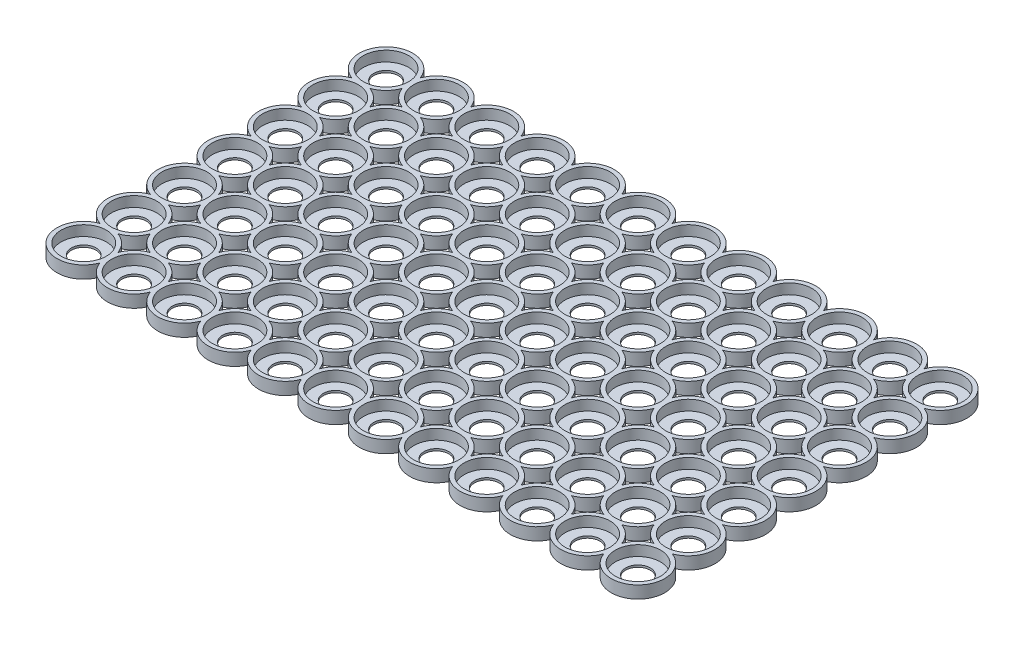
from build123d import *

# Parameters (mm, degrees)
LPATTERN1_COUNT = 7
LPATTERN1_PITCH = 24.5
LPATTERN2_COUNT = 12
LPATTERN2_PITCH = 24.5


with BuildPart() as part:
    # Sketch1 → Revolve1 (revolve)
    with BuildSketch(Plane(origin=(0, 0, 0), x_dir=(0, 0, -1), z_dir=(1, 0, 0))):
        Polygon((-13, 3), (-13, -3), (-6, -3), (-6, -2), (-11, -2), (-11, 3), align=None)
    revolve1 = revolve(axis=Axis((0, 27.077205882, 0), (0, -1, 0)))

    # LPattern1: Revolve1 ×7
    with Locations(*[(0, 0, -i * LPATTERN1_PITCH) for i in range(1, LPATTERN1_COUNT)]):
        add(revolve1)

    # LPattern2: Revolve1 ×12
    with Locations(*[(i * LPATTERN2_PITCH, 0, 0) for i in range(1, LPATTERN2_COUNT)]):
        add(revolve1)

    # LPattern2 copy 1 sketch → LPattern2 copy 1 (revolve)
    with BuildSketch(Plane(origin=(24.5, 0, -24.5), x_dir=(0, 0, -1), z_dir=(1, 0, 0))):
        Polygon((-13, 3), (-13, -3), (-6, -3), (-6, -2), (-11, -2), (-11, 3), align=None)
    revolve(axis=Axis((24.5, 27.077205882, -24.5), (0, -1, 0)))

    # LPattern2 copy 2 sketch → LPattern2 copy 2 (revolve)
    with BuildSketch(Plane(origin=(49, 0, -24.5), x_dir=(0, 0, -1), z_dir=(1, 0, 0))):
        Polygon((-13, 3), (-13, -3), (-6, -3), (-6, -2), (-11, -2), (-11, 3), align=None)
    revolve(axis=Axis((49, 27.077205882, -24.5), (0, -1, 0)))

    # LPattern2 copy 3 sketch → LPattern2 copy 3 (revolve)
    with BuildSketch(Plane(origin=(73.5, 0, -24.5), x_dir=(0, 0, -1), z_dir=(1, 0, 0))):
        Polygon((-13, 3), (-13, -3), (-6, -3), (-6, -2), (-11, -2), (-11, 3), align=None)
    revolve(axis=Axis((73.5, 27.077205882, -24.5), (0, -1, 0)))

    # LPattern2 copy 4 sketch → LPattern2 copy 4 (revolve)
    with BuildSketch(Plane(origin=(98, 0, -24.5), x_dir=(0, 0, -1), z_dir=(1, 0, 0))):
        Polygon((-13, 3), (-13, -3), (-6, -3), (-6, -2), (-11, -2), (-11, 3), align=None)
    revolve(axis=Axis((98, 27.077205882, -24.5), (0, -1, 0)))

    # LPattern2 copy 5 sketch → LPattern2 copy 5 (revolve)
    with BuildSketch(Plane(origin=(122.5, 0, -24.5), x_dir=(0, 0, -1), z_dir=(1, 0, 0))):
        Polygon((-13, 3), (-13, -3), (-6, -3), (-6, -2), (-11, -2), (-11, 3), align=None)
    revolve(axis=Axis((122.5, 27.077205882, -24.5), (0, -1, 0)))

    # LPattern2 copy 6 sketch → LPattern2 copy 6 (revolve)
    with BuildSketch(Plane(origin=(147, 0, -24.5), x_dir=(0, 0, -1), z_dir=(1, 0, 0))):
        Polygon((-13, 3), (-13, -3), (-6, -3), (-6, -2), (-11, -2), (-11, 3), align=None)
    revolve(axis=Axis((147, 27.077205882, -24.5), (0, -1, 0)))

    # LPattern2 copy 7 sketch → LPattern2 copy 7 (revolve)
    with BuildSketch(Plane(origin=(171.5, 0, -24.5), x_dir=(0, 0, -1), z_dir=(1, 0, 0))):
        Polygon((-13, 3), (-13, -3), (-6, -3), (-6, -2), (-11, -2), (-11, 3), align=None)
    revolve(axis=Axis((171.5, 27.077205882, -24.5), (0, -1, 0)))

    # LPattern2 copy 8 sketch → LPattern2 copy 8 (revolve)
    with BuildSketch(Plane(origin=(196, 0, -24.5), x_dir=(0, 0, -1), z_dir=(1, 0, 0))):
        Polygon((-13, 3), (-13, -3), (-6, -3), (-6, -2), (-11, -2), (-11, 3), align=None)
    revolve(axis=Axis((196, 27.077205882, -24.5), (0, -1, 0)))

    # LPattern2 copy 9 sketch → LPattern2 copy 9 (revolve)
    with BuildSketch(Plane(origin=(220.5, 0, -24.5), x_dir=(0, 0, -1), z_dir=(1, 0, 0))):
        Polygon((-13, 3), (-13, -3), (-6, -3), (-6, -2), (-11, -2), (-11, 3), align=None)
    revolve(axis=Axis((220.5, 27.077205882, -24.5), (0, -1, 0)))

    # LPattern2 copy 10 sketch → LPattern2 copy 10 (revolve)
    with BuildSketch(Plane(origin=(245, 0, -24.5), x_dir=(0, 0, -1), z_dir=(1, 0, 0))):
        Polygon((-13, 3), (-13, -3), (-6, -3), (-6, -2), (-11, -2), (-11, 3), align=None)
    revolve(axis=Axis((245, 27.077205882, -24.5), (0, -1, 0)))

    # LPattern2 copy 11 sketch → LPattern2 copy 11 (revolve)
    with BuildSketch(Plane(origin=(269.5, 0, -24.5), x_dir=(0, 0, -1), z_dir=(1, 0, 0))):
        Polygon((-13, 3), (-13, -3), (-6, -3), (-6, -2), (-11, -2), (-11, 3), align=None)
    revolve(axis=Axis((269.5, 27.077205882, -24.5), (0, -1, 0)))

    # LPattern2 copy 12 sketch → LPattern2 copy 12 (revolve)
    with BuildSketch(Plane(origin=(24.5, 0, -49), x_dir=(0, 0, -1), z_dir=(1, 0, 0))):
        Polygon((-13, 3), (-13, -3), (-6, -3), (-6, -2), (-11, -2), (-11, 3), align=None)
    revolve(axis=Axis((24.5, 27.077205882, -49), (0, -1, 0)))

    # LPattern2 copy 13 sketch → LPattern2 copy 13 (revolve)
    with BuildSketch(Plane(origin=(49, 0, -49), x_dir=(0, 0, -1), z_dir=(1, 0, 0))):
        Polygon((-13, 3), (-13, -3), (-6, -3), (-6, -2), (-11, -2), (-11, 3), align=None)
    revolve(axis=Axis((49, 27.077205882, -49), (0, -1, 0)))

    # LPattern2 copy 14 sketch → LPattern2 copy 14 (revolve)
    with BuildSketch(Plane(origin=(73.5, 0, -49), x_dir=(0, 0, -1), z_dir=(1, 0, 0))):
        Polygon((-13, 3), (-13, -3), (-6, -3), (-6, -2), (-11, -2), (-11, 3), align=None)
    revolve(axis=Axis((73.5, 27.077205882, -49), (0, -1, 0)))

    # LPattern2 copy 15 sketch → LPattern2 copy 15 (revolve)
    with BuildSketch(Plane(origin=(98, 0, -49), x_dir=(0, 0, -1), z_dir=(1, 0, 0))):
        Polygon((-13, 3), (-13, -3), (-6, -3), (-6, -2), (-11, -2), (-11, 3), align=None)
    revolve(axis=Axis((98, 27.077205882, -49), (0, -1, 0)))

    # LPattern2 copy 16 sketch → LPattern2 copy 16 (revolve)
    with BuildSketch(Plane(origin=(122.5, 0, -49), x_dir=(0, 0, -1), z_dir=(1, 0, 0))):
        Polygon((-13, 3), (-13, -3), (-6, -3), (-6, -2), (-11, -2), (-11, 3), align=None)
    revolve(axis=Axis((122.5, 27.077205882, -49), (0, -1, 0)))

    # LPattern2 copy 17 sketch → LPattern2 copy 17 (revolve)
    with BuildSketch(Plane(origin=(147, 0, -49), x_dir=(0, 0, -1), z_dir=(1, 0, 0))):
        Polygon((-13, 3), (-13, -3), (-6, -3), (-6, -2), (-11, -2), (-11, 3), align=None)
    revolve(axis=Axis((147, 27.077205882, -49), (0, -1, 0)))

    # LPattern2 copy 18 sketch → LPattern2 copy 18 (revolve)
    with BuildSketch(Plane(origin=(171.5, 0, -49), x_dir=(0, 0, -1), z_dir=(1, 0, 0))):
        Polygon((-13, 3), (-13, -3), (-6, -3), (-6, -2), (-11, -2), (-11, 3), align=None)
    revolve(axis=Axis((171.5, 27.077205882, -49), (0, -1, 0)))

    # LPattern2 copy 19 sketch → LPattern2 copy 19 (revolve)
    with BuildSketch(Plane(origin=(196, 0, -49), x_dir=(0, 0, -1), z_dir=(1, 0, 0))):
        Polygon((-13, 3), (-13, -3), (-6, -3), (-6, -2), (-11, -2), (-11, 3), align=None)
    revolve(axis=Axis((196, 27.077205882, -49), (0, -1, 0)))

    # LPattern2 copy 20 sketch → LPattern2 copy 20 (revolve)
    with BuildSketch(Plane(origin=(220.5, 0, -49), x_dir=(0, 0, -1), z_dir=(1, 0, 0))):
        Polygon((-13, 3), (-13, -3), (-6, -3), (-6, -2), (-11, -2), (-11, 3), align=None)
    revolve(axis=Axis((220.5, 27.077205882, -49), (0, -1, 0)))

    # LPattern2 copy 21 sketch → LPattern2 copy 21 (revolve)
    with BuildSketch(Plane(origin=(245, 0, -49), x_dir=(0, 0, -1), z_dir=(1, 0, 0))):
        Polygon((-13, 3), (-13, -3), (-6, -3), (-6, -2), (-11, -2), (-11, 3), align=None)
    revolve(axis=Axis((245, 27.077205882, -49), (0, -1, 0)))

    # LPattern2 copy 22 sketch → LPattern2 copy 22 (revolve)
    with BuildSketch(Plane(origin=(269.5, 0, -49), x_dir=(0, 0, -1), z_dir=(1, 0, 0))):
        Polygon((-13, 3), (-13, -3), (-6, -3), (-6, -2), (-11, -2), (-11, 3), align=None)
    revolve(axis=Axis((269.5, 27.077205882, -49), (0, -1, 0)))

    # LPattern2 copy 23 sketch → LPattern2 copy 23 (revolve)
    with BuildSketch(Plane(origin=(24.5, 0, -73.5), x_dir=(0, 0, -1), z_dir=(1, 0, 0))):
        Polygon((-13, 3), (-13, -3), (-6, -3), (-6, -2), (-11, -2), (-11, 3), align=None)
    revolve(axis=Axis((24.5, 27.077205882, -73.5), (0, -1, 0)))

    # LPattern2 copy 24 sketch → LPattern2 copy 24 (revolve)
    with BuildSketch(Plane(origin=(49, 0, -73.5), x_dir=(0, 0, -1), z_dir=(1, 0, 0))):
        Polygon((-13, 3), (-13, -3), (-6, -3), (-6, -2), (-11, -2), (-11, 3), align=None)
    revolve(axis=Axis((49, 27.077205882, -73.5), (0, -1, 0)))

    # LPattern2 copy 25 sketch → LPattern2 copy 25 (revolve)
    with BuildSketch(Plane(origin=(73.5, 0, -73.5), x_dir=(0, 0, -1), z_dir=(1, 0, 0))):
        Polygon((-13, 3), (-13, -3), (-6, -3), (-6, -2), (-11, -2), (-11, 3), align=None)
    revolve(axis=Axis((73.5, 27.077205882, -73.5), (0, -1, 0)))

    # LPattern2 copy 26 sketch → LPattern2 copy 26 (revolve)
    with BuildSketch(Plane(origin=(98, 0, -73.5), x_dir=(0, 0, -1), z_dir=(1, 0, 0))):
        Polygon((-13, 3), (-13, -3), (-6, -3), (-6, -2), (-11, -2), (-11, 3), align=None)
    revolve(axis=Axis((98, 27.077205882, -73.5), (0, -1, 0)))

    # LPattern2 copy 27 sketch → LPattern2 copy 27 (revolve)
    with BuildSketch(Plane(origin=(122.5, 0, -73.5), x_dir=(0, 0, -1), z_dir=(1, 0, 0))):
        Polygon((-13, 3), (-13, -3), (-6, -3), (-6, -2), (-11, -2), (-11, 3), align=None)
    revolve(axis=Axis((122.5, 27.077205882, -73.5), (0, -1, 0)))

    # LPattern2 copy 28 sketch → LPattern2 copy 28 (revolve)
    with BuildSketch(Plane(origin=(147, 0, -73.5), x_dir=(0, 0, -1), z_dir=(1, 0, 0))):
        Polygon((-13, 3), (-13, -3), (-6, -3), (-6, -2), (-11, -2), (-11, 3), align=None)
    revolve(axis=Axis((147, 27.077205882, -73.5), (0, -1, 0)))

    # LPattern2 copy 29 sketch → LPattern2 copy 29 (revolve)
    with BuildSketch(Plane(origin=(171.5, 0, -73.5), x_dir=(0, 0, -1), z_dir=(1, 0, 0))):
        Polygon((-13, 3), (-13, -3), (-6, -3), (-6, -2), (-11, -2), (-11, 3), align=None)
    revolve(axis=Axis((171.5, 27.077205882, -73.5), (0, -1, 0)))

    # LPattern2 copy 30 sketch → LPattern2 copy 30 (revolve)
    with BuildSketch(Plane(origin=(196, 0, -73.5), x_dir=(0, 0, -1), z_dir=(1, 0, 0))):
        Polygon((-13, 3), (-13, -3), (-6, -3), (-6, -2), (-11, -2), (-11, 3), align=None)
    revolve(axis=Axis((196, 27.077205882, -73.5), (0, -1, 0)))

    # LPattern2 copy 31 sketch → LPattern2 copy 31 (revolve)
    with BuildSketch(Plane(origin=(220.5, 0, -73.5), x_dir=(0, 0, -1), z_dir=(1, 0, 0))):
        Polygon((-13, 3), (-13, -3), (-6, -3), (-6, -2), (-11, -2), (-11, 3), align=None)
    revolve(axis=Axis((220.5, 27.077205882, -73.5), (0, -1, 0)))

    # LPattern2 copy 32 sketch → LPattern2 copy 32 (revolve)
    with BuildSketch(Plane(origin=(245, 0, -73.5), x_dir=(0, 0, -1), z_dir=(1, 0, 0))):
        Polygon((-13, 3), (-13, -3), (-6, -3), (-6, -2), (-11, -2), (-11, 3), align=None)
    revolve(axis=Axis((245, 27.077205882, -73.5), (0, -1, 0)))

    # LPattern2 copy 33 sketch → LPattern2 copy 33 (revolve)
    with BuildSketch(Plane(origin=(269.5, 0, -73.5), x_dir=(0, 0, -1), z_dir=(1, 0, 0))):
        Polygon((-13, 3), (-13, -3), (-6, -3), (-6, -2), (-11, -2), (-11, 3), align=None)
    revolve(axis=Axis((269.5, 27.077205882, -73.5), (0, -1, 0)))

    # LPattern2 copy 34 sketch → LPattern2 copy 34 (revolve)
    with BuildSketch(Plane(origin=(24.5, 0, -98), x_dir=(0, 0, -1), z_dir=(1, 0, 0))):
        Polygon((-13, 3), (-13, -3), (-6, -3), (-6, -2), (-11, -2), (-11, 3), align=None)
    revolve(axis=Axis((24.5, 27.077205882, -98), (0, -1, 0)))

    # LPattern2 copy 35 sketch → LPattern2 copy 35 (revolve)
    with BuildSketch(Plane(origin=(49, 0, -98), x_dir=(0, 0, -1), z_dir=(1, 0, 0))):
        Polygon((-13, 3), (-13, -3), (-6, -3), (-6, -2), (-11, -2), (-11, 3), align=None)
    revolve(axis=Axis((49, 27.077205882, -98), (0, -1, 0)))

    # LPattern2 copy 36 sketch → LPattern2 copy 36 (revolve)
    with BuildSketch(Plane(origin=(73.5, 0, -98), x_dir=(0, 0, -1), z_dir=(1, 0, 0))):
        Polygon((-13, 3), (-13, -3), (-6, -3), (-6, -2), (-11, -2), (-11, 3), align=None)
    revolve(axis=Axis((73.5, 27.077205882, -98), (0, -1, 0)))

    # LPattern2 copy 37 sketch → LPattern2 copy 37 (revolve)
    with BuildSketch(Plane(origin=(98, 0, -98), x_dir=(0, 0, -1), z_dir=(1, 0, 0))):
        Polygon((-13, 3), (-13, -3), (-6, -3), (-6, -2), (-11, -2), (-11, 3), align=None)
    revolve(axis=Axis((98, 27.077205882, -98), (0, -1, 0)))

    # LPattern2 copy 38 sketch → LPattern2 copy 38 (revolve)
    with BuildSketch(Plane(origin=(122.5, 0, -98), x_dir=(0, 0, -1), z_dir=(1, 0, 0))):
        Polygon((-13, 3), (-13, -3), (-6, -3), (-6, -2), (-11, -2), (-11, 3), align=None)
    revolve(axis=Axis((122.5, 27.077205882, -98), (0, -1, 0)))

    # LPattern2 copy 39 sketch → LPattern2 copy 39 (revolve)
    with BuildSketch(Plane(origin=(147, 0, -98), x_dir=(0, 0, -1), z_dir=(1, 0, 0))):
        Polygon((-13, 3), (-13, -3), (-6, -3), (-6, -2), (-11, -2), (-11, 3), align=None)
    revolve(axis=Axis((147, 27.077205882, -98), (0, -1, 0)))

    # LPattern2 copy 40 sketch → LPattern2 copy 40 (revolve)
    with BuildSketch(Plane(origin=(171.5, 0, -98), x_dir=(0, 0, -1), z_dir=(1, 0, 0))):
        Polygon((-13, 3), (-13, -3), (-6, -3), (-6, -2), (-11, -2), (-11, 3), align=None)
    revolve(axis=Axis((171.5, 27.077205882, -98), (0, -1, 0)))

    # LPattern2 copy 41 sketch → LPattern2 copy 41 (revolve)
    with BuildSketch(Plane(origin=(196, 0, -98), x_dir=(0, 0, -1), z_dir=(1, 0, 0))):
        Polygon((-13, 3), (-13, -3), (-6, -3), (-6, -2), (-11, -2), (-11, 3), align=None)
    revolve(axis=Axis((196, 27.077205882, -98), (0, -1, 0)))

    # LPattern2 copy 42 sketch → LPattern2 copy 42 (revolve)
    with BuildSketch(Plane(origin=(220.5, 0, -98), x_dir=(0, 0, -1), z_dir=(1, 0, 0))):
        Polygon((-13, 3), (-13, -3), (-6, -3), (-6, -2), (-11, -2), (-11, 3), align=None)
    revolve(axis=Axis((220.5, 27.077205882, -98), (0, -1, 0)))

    # LPattern2 copy 43 sketch → LPattern2 copy 43 (revolve)
    with BuildSketch(Plane(origin=(245, 0, -98), x_dir=(0, 0, -1), z_dir=(1, 0, 0))):
        Polygon((-13, 3), (-13, -3), (-6, -3), (-6, -2), (-11, -2), (-11, 3), align=None)
    revolve(axis=Axis((245, 27.077205882, -98), (0, -1, 0)))

    # LPattern2 copy 44 sketch → LPattern2 copy 44 (revolve)
    with BuildSketch(Plane(origin=(269.5, 0, -98), x_dir=(0, 0, -1), z_dir=(1, 0, 0))):
        Polygon((-13, 3), (-13, -3), (-6, -3), (-6, -2), (-11, -2), (-11, 3), align=None)
    revolve(axis=Axis((269.5, 27.077205882, -98), (0, -1, 0)))

    # LPattern2 copy 45 sketch → LPattern2 copy 45 (revolve)
    with BuildSketch(Plane(origin=(24.5, 0, -122.5), x_dir=(0, 0, -1), z_dir=(1, 0, 0))):
        Polygon((-13, 3), (-13, -3), (-6, -3), (-6, -2), (-11, -2), (-11, 3), align=None)
    revolve(axis=Axis((24.5, 27.077205882, -122.5), (0, -1, 0)))

    # LPattern2 copy 46 sketch → LPattern2 copy 46 (revolve)
    with BuildSketch(Plane(origin=(49, 0, -122.5), x_dir=(0, 0, -1), z_dir=(1, 0, 0))):
        Polygon((-13, 3), (-13, -3), (-6, -3), (-6, -2), (-11, -2), (-11, 3), align=None)
    revolve(axis=Axis((49, 27.077205882, -122.5), (0, -1, 0)))

    # LPattern2 copy 47 sketch → LPattern2 copy 47 (revolve)
    with BuildSketch(Plane(origin=(73.5, 0, -122.5), x_dir=(0, 0, -1), z_dir=(1, 0, 0))):
        Polygon((-13, 3), (-13, -3), (-6, -3), (-6, -2), (-11, -2), (-11, 3), align=None)
    revolve(axis=Axis((73.5, 27.077205882, -122.5), (0, -1, 0)))

    # LPattern2 copy 48 sketch → LPattern2 copy 48 (revolve)
    with BuildSketch(Plane(origin=(98, 0, -122.5), x_dir=(0, 0, -1), z_dir=(1, 0, 0))):
        Polygon((-13, 3), (-13, -3), (-6, -3), (-6, -2), (-11, -2), (-11, 3), align=None)
    revolve(axis=Axis((98, 27.077205882, -122.5), (0, -1, 0)))

    # LPattern2 copy 49 sketch → LPattern2 copy 49 (revolve)
    with BuildSketch(Plane(origin=(122.5, 0, -122.5), x_dir=(0, 0, -1), z_dir=(1, 0, 0))):
        Polygon((-13, 3), (-13, -3), (-6, -3), (-6, -2), (-11, -2), (-11, 3), align=None)
    revolve(axis=Axis((122.5, 27.077205882, -122.5), (0, -1, 0)))

    # LPattern2 copy 50 sketch → LPattern2 copy 50 (revolve)
    with BuildSketch(Plane(origin=(147, 0, -122.5), x_dir=(0, 0, -1), z_dir=(1, 0, 0))):
        Polygon((-13, 3), (-13, -3), (-6, -3), (-6, -2), (-11, -2), (-11, 3), align=None)
    revolve(axis=Axis((147, 27.077205882, -122.5), (0, -1, 0)))

    # LPattern2 copy 51 sketch → LPattern2 copy 51 (revolve)
    with BuildSketch(Plane(origin=(171.5, 0, -122.5), x_dir=(0, 0, -1), z_dir=(1, 0, 0))):
        Polygon((-13, 3), (-13, -3), (-6, -3), (-6, -2), (-11, -2), (-11, 3), align=None)
    revolve(axis=Axis((171.5, 27.077205882, -122.5), (0, -1, 0)))

    # LPattern2 copy 52 sketch → LPattern2 copy 52 (revolve)
    with BuildSketch(Plane(origin=(196, 0, -122.5), x_dir=(0, 0, -1), z_dir=(1, 0, 0))):
        Polygon((-13, 3), (-13, -3), (-6, -3), (-6, -2), (-11, -2), (-11, 3), align=None)
    revolve(axis=Axis((196, 27.077205882, -122.5), (0, -1, 0)))

    # LPattern2 copy 53 sketch → LPattern2 copy 53 (revolve)
    with BuildSketch(Plane(origin=(220.5, 0, -122.5), x_dir=(0, 0, -1), z_dir=(1, 0, 0))):
        Polygon((-13, 3), (-13, -3), (-6, -3), (-6, -2), (-11, -2), (-11, 3), align=None)
    revolve(axis=Axis((220.5, 27.077205882, -122.5), (0, -1, 0)))

    # LPattern2 copy 54 sketch → LPattern2 copy 54 (revolve)
    with BuildSketch(Plane(origin=(245, 0, -122.5), x_dir=(0, 0, -1), z_dir=(1, 0, 0))):
        Polygon((-13, 3), (-13, -3), (-6, -3), (-6, -2), (-11, -2), (-11, 3), align=None)
    revolve(axis=Axis((245, 27.077205882, -122.5), (0, -1, 0)))

    # LPattern2 copy 55 sketch → LPattern2 copy 55 (revolve)
    with BuildSketch(Plane(origin=(269.5, 0, -122.5), x_dir=(0, 0, -1), z_dir=(1, 0, 0))):
        Polygon((-13, 3), (-13, -3), (-6, -3), (-6, -2), (-11, -2), (-11, 3), align=None)
    revolve(axis=Axis((269.5, 27.077205882, -122.5), (0, -1, 0)))

    # LPattern2 copy 56 sketch → LPattern2 copy 56 (revolve)
    with BuildSketch(Plane(origin=(24.5, 0, -147), x_dir=(0, 0, -1), z_dir=(1, 0, 0))):
        Polygon((-13, 3), (-13, -3), (-6, -3), (-6, -2), (-11, -2), (-11, 3), align=None)
    revolve(axis=Axis((24.5, 27.077205882, -147), (0, -1, 0)))

    # LPattern2 copy 57 sketch → LPattern2 copy 57 (revolve)
    with BuildSketch(Plane(origin=(49, 0, -147), x_dir=(0, 0, -1), z_dir=(1, 0, 0))):
        Polygon((-13, 3), (-13, -3), (-6, -3), (-6, -2), (-11, -2), (-11, 3), align=None)
    revolve(axis=Axis((49, 27.077205882, -147), (0, -1, 0)))

    # LPattern2 copy 58 sketch → LPattern2 copy 58 (revolve)
    with BuildSketch(Plane(origin=(73.5, 0, -147), x_dir=(0, 0, -1), z_dir=(1, 0, 0))):
        Polygon((-13, 3), (-13, -3), (-6, -3), (-6, -2), (-11, -2), (-11, 3), align=None)
    revolve(axis=Axis((73.5, 27.077205882, -147), (0, -1, 0)))

    # LPattern2 copy 59 sketch → LPattern2 copy 59 (revolve)
    with BuildSketch(Plane(origin=(98, 0, -147), x_dir=(0, 0, -1), z_dir=(1, 0, 0))):
        Polygon((-13, 3), (-13, -3), (-6, -3), (-6, -2), (-11, -2), (-11, 3), align=None)
    revolve(axis=Axis((98, 27.077205882, -147), (0, -1, 0)))

    # LPattern2 copy 60 sketch → LPattern2 copy 60 (revolve)
    with BuildSketch(Plane(origin=(122.5, 0, -147), x_dir=(0, 0, -1), z_dir=(1, 0, 0))):
        Polygon((-13, 3), (-13, -3), (-6, -3), (-6, -2), (-11, -2), (-11, 3), align=None)
    revolve(axis=Axis((122.5, 27.077205882, -147), (0, -1, 0)))

    # LPattern2 copy 61 sketch → LPattern2 copy 61 (revolve)
    with BuildSketch(Plane(origin=(147, 0, -147), x_dir=(0, 0, -1), z_dir=(1, 0, 0))):
        Polygon((-13, 3), (-13, -3), (-6, -3), (-6, -2), (-11, -2), (-11, 3), align=None)
    revolve(axis=Axis((147, 27.077205882, -147), (0, -1, 0)))

    # LPattern2 copy 62 sketch → LPattern2 copy 62 (revolve)
    with BuildSketch(Plane(origin=(171.5, 0, -147), x_dir=(0, 0, -1), z_dir=(1, 0, 0))):
        Polygon((-13, 3), (-13, -3), (-6, -3), (-6, -2), (-11, -2), (-11, 3), align=None)
    revolve(axis=Axis((171.5, 27.077205882, -147), (0, -1, 0)))

    # LPattern2 copy 63 sketch → LPattern2 copy 63 (revolve)
    with BuildSketch(Plane(origin=(196, 0, -147), x_dir=(0, 0, -1), z_dir=(1, 0, 0))):
        Polygon((-13, 3), (-13, -3), (-6, -3), (-6, -2), (-11, -2), (-11, 3), align=None)
    revolve(axis=Axis((196, 27.077205882, -147), (0, -1, 0)))

    # LPattern2 copy 64 sketch → LPattern2 copy 64 (revolve)
    with BuildSketch(Plane(origin=(220.5, 0, -147), x_dir=(0, 0, -1), z_dir=(1, 0, 0))):
        Polygon((-13, 3), (-13, -3), (-6, -3), (-6, -2), (-11, -2), (-11, 3), align=None)
    revolve(axis=Axis((220.5, 27.077205882, -147), (0, -1, 0)))

    # LPattern2 copy 65 sketch → LPattern2 copy 65 (revolve)
    with BuildSketch(Plane(origin=(245, 0, -147), x_dir=(0, 0, -1), z_dir=(1, 0, 0))):
        Polygon((-13, 3), (-13, -3), (-6, -3), (-6, -2), (-11, -2), (-11, 3), align=None)
    revolve(axis=Axis((245, 27.077205882, -147), (0, -1, 0)))

    # LPattern2 copy 66 sketch → LPattern2 copy 66 (revolve)
    with BuildSketch(Plane(origin=(269.5, 0, -147), x_dir=(0, 0, -1), z_dir=(1, 0, 0))):
        Polygon((-13, 3), (-13, -3), (-6, -3), (-6, -2), (-11, -2), (-11, 3), align=None)
    revolve(axis=Axis((269.5, 27.077205882, -147), (0, -1, 0)))


solid = part.part
